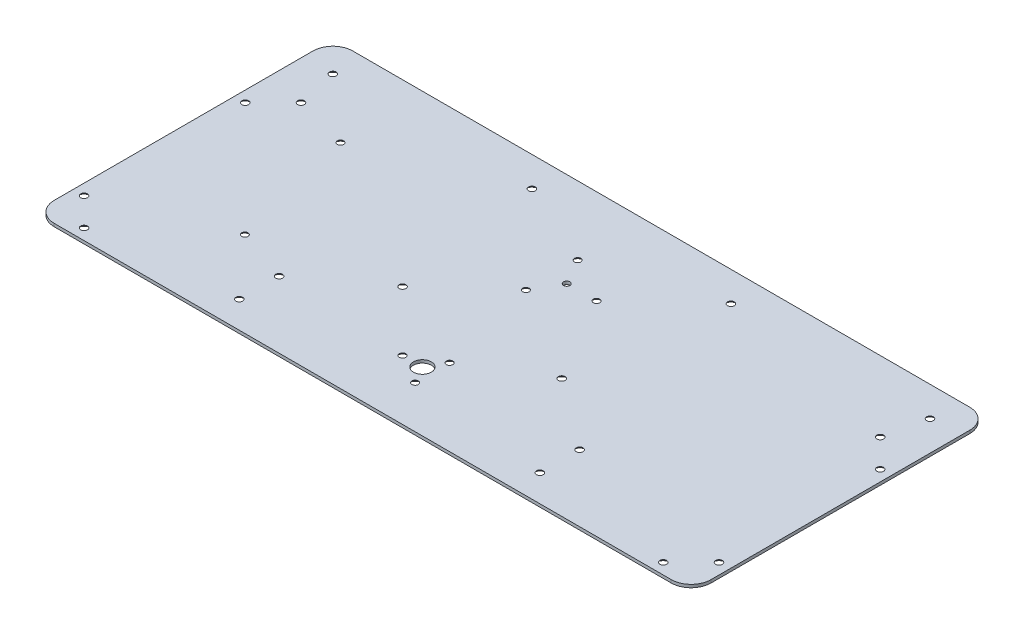
from build123d import *

# Parameters (mm, degrees)
ESQUISSE1_W                                 = 330
ESQUISSE1_H                                 = 150
ESQUISSE1_R                                 = 4.5
BOSS_EXTRU_1_DEPTH                          = 1.5
FRAISAGE_POUR_VIS_T_TE_FRAIS_E_M31_AT_COUNT = 2
FRAISAGE_POUR_VIS_T_TE_FRAIS_E_M31_AT_PITCH = 17.320508076
FRAISAGE_POUR_VIS_T_TE_FRAIS_E_M31_2_COUNT  = 2
FRAISAGE_POUR_VIS_T_TE_FRAIS_E_M31_2_PITCH  = 17.320508076
CONG_2_R                                    = 10
ESQUISSE4_R                                 = 1.6
ENL_V_MAT_EXTRU_1_DEPTH                     = 205.027571666
CHANFREIN1_SIZE                             = 1.4
FRAISAGE_POUR_VIS_T_TE_FRAIS_E_M32_AT_COUNT = 2
FRAISAGE_POUR_VIS_T_TE_FRAIS_E_M32_AT_PITCH = 20
FRAISAGE_POUR_VIS_T_TE_FRAIS_E_M32_2_COUNT  = 2
FRAISAGE_POUR_VIS_T_TE_FRAIS_E_M32_2_PITCH  = 152.318744743
FRAISAGE_POUR_VIS_T_TE_FRAIS_E_M32_3_COUNT  = 2
FRAISAGE_POUR_VIS_T_TE_FRAIS_E_M32_3_PITCH  = 151
FRAISAGE_POUR_VIS_T_TE_FRAIS_E_M32_4_COUNT  = 2
FRAISAGE_POUR_VIS_T_TE_FRAIS_E_M32_4_PITCH  = 85.158675424
FRAISAGE_POUR_VIS_T_TE_FRAIS_E_M32_5_COUNT  = 2
FRAISAGE_POUR_VIS_T_TE_FRAIS_E_M32_5_PITCH  = 75.3923073
FRAISAGE_POUR_VIS_T_TE_FRAIS_E_M32_6_COUNT  = 2
FRAISAGE_POUR_VIS_T_TE_FRAIS_E_M32_6_PITCH  = 107.447661678
FRAISAGE_POUR_VIS_T_TE_FRAIS_E_M32_7_COUNT  = 2
FRAISAGE_POUR_VIS_T_TE_FRAIS_E_M32_7_PITCH  = 107.056060081
FRAISAGE_POUR_VIS_T_TE_FRAIS_E_M32_8_COUNT  = 2
FRAISAGE_POUR_VIS_T_TE_FRAIS_E_M32_8_PITCH  = 222.766694099
FRAISAGE_POUR_VIS_T_TE_FRAIS_E_M32_9_COUNT  = 2
FRAISAGE_POUR_VIS_T_TE_FRAIS_E_M32_9_PITCH  = 235.416651917
FRAISAGE_POUR_VIS_T_TE_FRAIS_E_M32_10_COUNT = 2
FRAISAGE_POUR_VIS_T_TE_FRAIS_E_M32_10_PITCH = 235.376294473
FRAISAGE_POUR_VIS_T_TE_FRAIS_E_M32_11_COUNT = 2
FRAISAGE_POUR_VIS_T_TE_FRAIS_E_M32_11_PITCH = 244.364481871
FRAISAGE_POUR_VIS_T_TE_FRAIS_E_M32_12_COUNT = 2
FRAISAGE_POUR_VIS_T_TE_FRAIS_E_M32_12_PITCH = 125.906711497
FRAISAGE_POUR_VIS_T_TE_FRAIS_E_M32_13_COUNT = 2
FRAISAGE_POUR_VIS_T_TE_FRAIS_E_M32_13_PITCH = 104.654192463
FRAISAGE_POUR_VIS_T_TE_FRAIS_E_M32_14_COUNT = 2
FRAISAGE_POUR_VIS_T_TE_FRAIS_E_M32_14_PITCH = 44.300112867
FRAISAGE_POUR_VIS_T_TE_FRAIS_E_M32_15_COUNT = 2
FRAISAGE_POUR_VIS_T_TE_FRAIS_E_M32_15_PITCH = 118.501054848
FRAISAGE_POUR_VIS_T_TE_FRAIS_E_M32_16_COUNT = 2
FRAISAGE_POUR_VIS_T_TE_FRAIS_E_M32_16_PITCH = 161.407868458
FRAISAGE_POUR_VIS_T_TE_FRAIS_E_M32_17_COUNT = 2
FRAISAGE_POUR_VIS_T_TE_FRAIS_E_M32_17_PITCH = 247.290315217
FRAISAGE_POUR_VIS_T_TE_FRAIS_E_M32_18_COUNT = 2
FRAISAGE_POUR_VIS_T_TE_FRAIS_E_M32_18_PITCH = 357.617757774


with BuildPart() as part:
    # Esquisse1 → Boss.-Extru.1 (new body)
    with BuildSketch(Plane(origin=(0, 0, 0), x_dir=(1, 0, 0), z_dir=(0, 1, 0))):
        with Locations((0, 45)):
            Rectangle(ESQUISSE1_W, ESQUISSE1_H)
        Circle(ESQUISSE1_R, mode=Mode.SUBTRACT)
    extrude(amount=BOSS_EXTRU_1_DEPTH)

    # Esquisse3 → Fraisage pour vis à tête fraisée M31 (revolve, cut)
    with BuildSketch(Plane(origin=(5, 0, -8.660254038), x_dir=(0, 0, -1), z_dir=(1, 0, 0))):
        Polygon((0, 0), (0, 1.5), (1.6, 1.5), (1.6, 1.4), (3, 0), align=None)
    fraisage_pour_vis_t_te_frais_e_m31 = revolve(axis=Axis((5, -6.35, -8.660254038), (0, 1, 0)), mode=Mode.SUBTRACT)

    # Fraisage pour vis à tête fraisée M31 at: Fraisage pour vis à tête fraisée M31 ×2
    with Locations(*[(0, 0, i * FRAISAGE_POUR_VIS_T_TE_FRAIS_E_M31_AT_PITCH) for i in range(1, FRAISAGE_POUR_VIS_T_TE_FRAIS_E_M31_AT_COUNT)]):
        add(fraisage_pour_vis_t_te_frais_e_m31, mode=Mode.SUBTRACT)

    # Fraisage pour vis _ t_te frais_e M31 2: Fraisage pour vis à tête fraisée M31 ×2
    with Locations(*[Vector(-0.8660254037844397, 0, 0.49999999999999806) * (i * FRAISAGE_POUR_VIS_T_TE_FRAIS_E_M31_2_PITCH) for i in range(1, FRAISAGE_POUR_VIS_T_TE_FRAIS_E_M31_2_COUNT)]):
        add(fraisage_pour_vis_t_te_frais_e_m31, mode=Mode.SUBTRACT)

    # Congé2
    cong_2_edges = [part.edges().sort_by_distance(p)[0] for p in [
        (165, 0.75, -120),
        (165, 0.75, 30),
        (-165, 0.75, 30),
        (-165, 0.75, -120),
    ]]
    fillet(cong_2_edges, radius=CONG_2_R)

    # Esquisse4 → Enlèv. mat.-Extru.1 (cut, through all)
    with BuildSketch(Plane(origin=(0, 1.5, 0), x_dir=(1, 0, 0), z_dir=(0, 1, 0))):
        with Locations((-102.23074819, 13.000761956)):
            Circle(ESQUISSE4_R)
        with Locations((-118.1975933, 77.04027989)):
            Circle(ESQUISSE4_R)
        with Locations((15, 72.5)):
            Circle(ESQUISSE4_R)
        with Locations((-7.5, 85.490381057)):
            Circle(ESQUISSE4_R)
        with Locations((-7.5, 59.509618943)):
            Circle(ESQUISSE4_R)
        with Locations((0, 72.5)):
            Circle(ESQUISSE4_R)
    extrude(amount=-ENL_V_MAT_EXTRU_1_DEPTH, mode=Mode.SUBTRACT)

    # Chanfrein1
    chanfrein1_edges = [part.edges().sort_by_distance(p)[0] for p in [
        (-119.7975933, 0, -77.04027989),
        (-103.83074819, 0, -13.000761956),
        (-9.1, 0, -59.509618943),
        (-9.1, 0, -85.490381057),
        (13.4, 0, -72.5),
    ]]
    chamfer(chanfrein1_edges, length=CHANFREIN1_SIZE)

    # Esquisse6 → Fraisage pour vis à tête fraisée M32 (revolve, cut)
    with BuildSketch(Plane(origin=(75.5, 0, -3.5), x_dir=(0, 0, -1), z_dir=(1, 0, 0))):
        Polygon((0, 0), (0, 1.5), (1.7, 1.5), (1.7, 1.45), (3.15, 0), align=None)
    fraisage_pour_vis_t_te_frais_e_m32 = revolve(axis=Axis((75.5, -6.35, -3.5), (0, 1, 0)), mode=Mode.SUBTRACT)

    # Fraisage pour vis à tête fraisée M32 at: Fraisage pour vis à tête fraisée M32 ×2
    with Locations(*[(0, 0, i * FRAISAGE_POUR_VIS_T_TE_FRAIS_E_M32_AT_PITCH) for i in range(1, FRAISAGE_POUR_VIS_T_TE_FRAIS_E_M32_AT_COUNT)]):
        add(fraisage_pour_vis_t_te_frais_e_m32, mode=Mode.SUBTRACT)

    # Fraisage pour vis _ t_te frais_e M32 2: Fraisage pour vis à tête fraisée M32 ×2
    with Locations(*[Vector(-0.9913422031874387, 0, 0.1313036030711839) * (i * FRAISAGE_POUR_VIS_T_TE_FRAIS_E_M32_2_PITCH) for i in range(1, FRAISAGE_POUR_VIS_T_TE_FRAIS_E_M32_2_COUNT)]):
        add(fraisage_pour_vis_t_te_frais_e_m32, mode=Mode.SUBTRACT)

    # Fraisage pour vis _ t_te frais_e M32 3: Fraisage pour vis à tête fraisée M32 ×2
    with Locations(*[(-i * FRAISAGE_POUR_VIS_T_TE_FRAIS_E_M32_3_PITCH, 0, 0) for i in range(1, FRAISAGE_POUR_VIS_T_TE_FRAIS_E_M32_3_COUNT)]):
        add(fraisage_pour_vis_t_te_frais_e_m32, mode=Mode.SUBTRACT)

    # Fraisage pour vis _ t_te frais_e M32 4: Fraisage pour vis à tête fraisée M32 ×2
    with Locations(*[Vector(0.9863939238321435, 0, 0.1643989873053589) * (i * FRAISAGE_POUR_VIS_T_TE_FRAIS_E_M32_4_PITCH) for i in range(1, FRAISAGE_POUR_VIS_T_TE_FRAIS_E_M32_4_COUNT)]):
        add(fraisage_pour_vis_t_te_frais_e_m32, mode=Mode.SUBTRACT)

    # Fraisage pour vis _ t_te frais_e M32 5: Fraisage pour vis à tête fraisée M32 ×2
    with Locations(*[Vector(0.9284766908852593, 0, 0.3713906763541037) * (i * FRAISAGE_POUR_VIS_T_TE_FRAIS_E_M32_5_PITCH) for i in range(1, FRAISAGE_POUR_VIS_T_TE_FRAIS_E_M32_5_COUNT)]):
        add(fraisage_pour_vis_t_te_frais_e_m32, mode=Mode.SUBTRACT)

    # Fraisage pour vis _ t_te frais_e M32 6: Fraisage pour vis à tête fraisée M32 ×2
    with Locations(*[Vector(0.7817759706301133, 0, -0.6235594051454475) * (i * FRAISAGE_POUR_VIS_T_TE_FRAIS_E_M32_6_PITCH) for i in range(1, FRAISAGE_POUR_VIS_T_TE_FRAIS_E_M32_6_COUNT)]):
        add(fraisage_pour_vis_t_te_frais_e_m32, mode=Mode.SUBTRACT)

    # Fraisage pour vis _ t_te frais_e M32 7: Fraisage pour vis à tête fraisée M32 ×2
    with Locations(*[Vector(0.6538630316419344, 0, -0.7566129366142366) * (i * FRAISAGE_POUR_VIS_T_TE_FRAIS_E_M32_7_PITCH) for i in range(1, FRAISAGE_POUR_VIS_T_TE_FRAIS_E_M32_7_COUNT)]):
        add(fraisage_pour_vis_t_te_frais_e_m32, mode=Mode.SUBTRACT)

    # Fraisage pour vis _ t_te frais_e M32 8: Fraisage pour vis à tête fraisée M32 ×2
    with Locations(*[Vector(-0.9920693077275461, 0, 0.12569203898810538) * (i * FRAISAGE_POUR_VIS_T_TE_FRAIS_E_M32_8_PITCH) for i in range(1, FRAISAGE_POUR_VIS_T_TE_FRAIS_E_M32_8_COUNT)]):
        add(fraisage_pour_vis_t_te_frais_e_m32, mode=Mode.SUBTRACT)

    # Fraisage pour vis _ t_te frais_e M32 9: Fraisage pour vis à tête fraisée M32 ×2
    with Locations(*[Vector(-0.9982301510364278, 0, 0.05946903027451117) * (i * FRAISAGE_POUR_VIS_T_TE_FRAIS_E_M32_9_PITCH) for i in range(1, FRAISAGE_POUR_VIS_T_TE_FRAIS_E_M32_9_COUNT)]):
        add(fraisage_pour_vis_t_te_frais_e_m32, mode=Mode.SUBTRACT)

    # Fraisage pour vis _ t_te frais_e M32 10: Fraisage pour vis à tête fraisée M32 ×2
    with Locations(*[Vector(-0.9389220800441849, 0, -0.344129812142891) * (i * FRAISAGE_POUR_VIS_T_TE_FRAIS_E_M32_10_PITCH) for i in range(1, FRAISAGE_POUR_VIS_T_TE_FRAIS_E_M32_10_COUNT)]):
        add(fraisage_pour_vis_t_te_frais_e_m32, mode=Mode.SUBTRACT)

    # Fraisage pour vis _ t_te frais_e M32 11: Fraisage pour vis à tête fraisée M32 ×2
    with Locations(*[Vector(-0.9616782201769339, 0, -0.27418059894406194) * (i * FRAISAGE_POUR_VIS_T_TE_FRAIS_E_M32_11_PITCH) for i in range(1, FRAISAGE_POUR_VIS_T_TE_FRAIS_E_M32_11_COUNT)]):
        add(fraisage_pour_vis_t_te_frais_e_m32, mode=Mode.SUBTRACT)

    # Fraisage pour vis _ t_te frais_e M32 12: Fraisage pour vis à tête fraisée M32 ×2
    with Locations(*[Vector(0.5917079329146707, 0, -0.8061524186689808) * (i * FRAISAGE_POUR_VIS_T_TE_FRAIS_E_M32_12_PITCH) for i in range(1, FRAISAGE_POUR_VIS_T_TE_FRAIS_E_M32_12_COUNT)]):
        add(fraisage_pour_vis_t_te_frais_e_m32, mode=Mode.SUBTRACT)

    # Fraisage pour vis _ t_te frais_e M32 13: Fraisage pour vis à tête fraisée M32 ×2
    with Locations(*[Vector(-0.2436596126725799, 0, -0.9698608112261514) * (i * FRAISAGE_POUR_VIS_T_TE_FRAIS_E_M32_13_PITCH) for i in range(1, FRAISAGE_POUR_VIS_T_TE_FRAIS_E_M32_13_COUNT)]):
        add(fraisage_pour_vis_t_te_frais_e_m32, mode=Mode.SUBTRACT)

    # Fraisage pour vis _ t_te frais_e M32 14: Fraisage pour vis à tête fraisée M32 ×2
    with Locations(*[Vector(-0.8013523601360025, 0, -0.5981926068620863) * (i * FRAISAGE_POUR_VIS_T_TE_FRAIS_E_M32_14_PITCH) for i in range(1, FRAISAGE_POUR_VIS_T_TE_FRAIS_E_M32_14_COUNT)]):
        add(fraisage_pour_vis_t_te_frais_e_m32, mode=Mode.SUBTRACT)

    # Fraisage pour vis _ t_te frais_e M32 15: Fraisage pour vis à tête fraisée M32 ×2
    with Locations(*[Vector(-0.9746748680719794, 0, -0.223626701332532) * (i * FRAISAGE_POUR_VIS_T_TE_FRAIS_E_M32_15_PITCH) for i in range(1, FRAISAGE_POUR_VIS_T_TE_FRAIS_E_M32_15_COUNT)]):
        add(fraisage_pour_vis_t_te_frais_e_m32, mode=Mode.SUBTRACT)

    # Fraisage pour vis _ t_te frais_e M32 16: Fraisage pour vis à tête fraisée M32 ×2
    with Locations(*[Vector(-0.777533345798627, 0, -0.6288417099486903) * (i * FRAISAGE_POUR_VIS_T_TE_FRAIS_E_M32_16_PITCH) for i in range(1, FRAISAGE_POUR_VIS_T_TE_FRAIS_E_M32_16_COUNT)]):
        add(fraisage_pour_vis_t_te_frais_e_m32, mode=Mode.SUBTRACT)

    # Fraisage pour vis _ t_te frais_e M32 17: Fraisage pour vis à tête fraisée M32 ×2
    with Locations(*[Vector(-0.9118836692102092, 0, -0.41044874689506083) * (i * FRAISAGE_POUR_VIS_T_TE_FRAIS_E_M32_17_PITCH) for i in range(1, FRAISAGE_POUR_VIS_T_TE_FRAIS_E_M32_17_COUNT)]):
        add(fraisage_pour_vis_t_te_frais_e_m32, mode=Mode.SUBTRACT)

    # Fraisage pour vis _ t_te frais_e M32 18: Fraisage pour vis à tête fraisée M32 ×2
    with Locations(*[Vector(-0.9699587949702458, 0, 0.24326926657485654) * (i * FRAISAGE_POUR_VIS_T_TE_FRAIS_E_M32_18_PITCH) for i in range(1, FRAISAGE_POUR_VIS_T_TE_FRAIS_E_M32_18_COUNT)]):
        add(fraisage_pour_vis_t_te_frais_e_m32, mode=Mode.SUBTRACT)


solid = part.part
